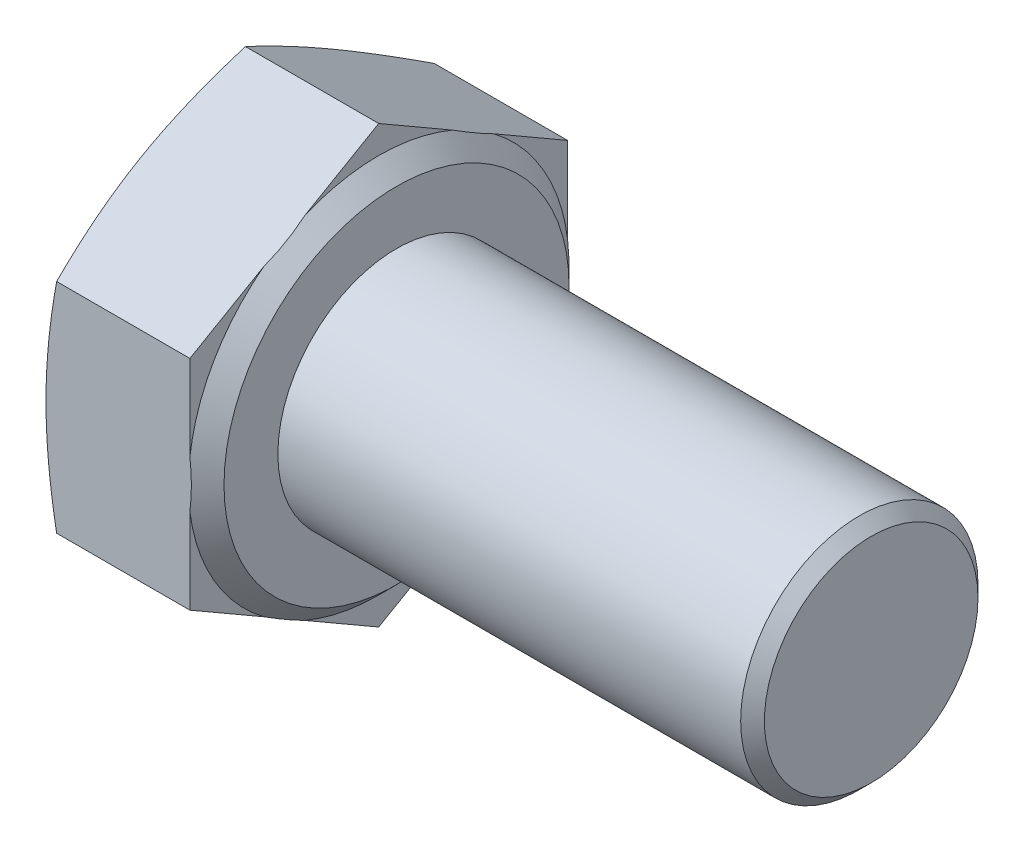
from build123d import *

# Parameters (mm, degrees)
BASEHEAD_DEPTH = 5.45
SKETCH5_R      = 4
BASEBODY_DEPTH = 16


with BuildPart() as part:
    # Sketch2 → BaseHead (new body)
    with BuildSketch(Plane(origin=(0, 0, 0), x_dir=(0, 0, -1), z_dir=(1, 0, 0))):
        Polygon((6.365, -3.674834463), (6.365, 3.674834463), (0, 7.349668927), (-6.365, 3.674834463), (-6.365, -3.674834463), (0, -7.349668927), align=None)
    extrude(amount=BASEHEAD_DEPTH)

    # Sketch3 → BearingFace (revolve, cut)
    with BuildSketch(Plane.XY, mode=Mode.PRIVATE) as bearingface_sk:
        Polygon((5.45, 7.349668927), (5.45, 5.815), (4.85, 6.415), (4.85, 7.349668927), align=None)
    revolve(bearingface_sk.sketch.rotate(Axis((-0.957090588, 0, 0), (1, 0, 0)), 90), axis=Axis((-0.957090588, 0, 0), (1, 0, 0)), mode=Mode.SUBTRACT)

    # Sketch4 → HeadChamfer (revolve, cut)
    with BuildSketch(Plane.XY):
        Polygon((0, 7.349668927), (0.35839018, 7.349668927), (0, 6.365), align=None)
    revolve(axis=Axis((-0.493528746, 0, 0), (1, 0, 0)), mode=Mode.SUBTRACT)

    # Sketch5 → BaseBody (add)
    with BuildSketch(Plane(origin=(5.45, 0, 0), x_dir=(0, 0, -1), z_dir=(1, 0, 0))):
        Circle(SKETCH5_R)
    extrude(amount=BASEBODY_DEPTH)

    # Chamfer1: read off the stored shape, not the designer's step
    # Chamfer1 outline → Chamfer1 (revolve, cut)
    with BuildSketch(Plane.YX):
        Polygon((4, 21.45), (3.6, 21.45), (4, 21.05), align=None)
    revolve(axis=Axis((0, 0, 0), (1, 0, 0)), mode=Mode.SUBTRACT)


solid = part.part
